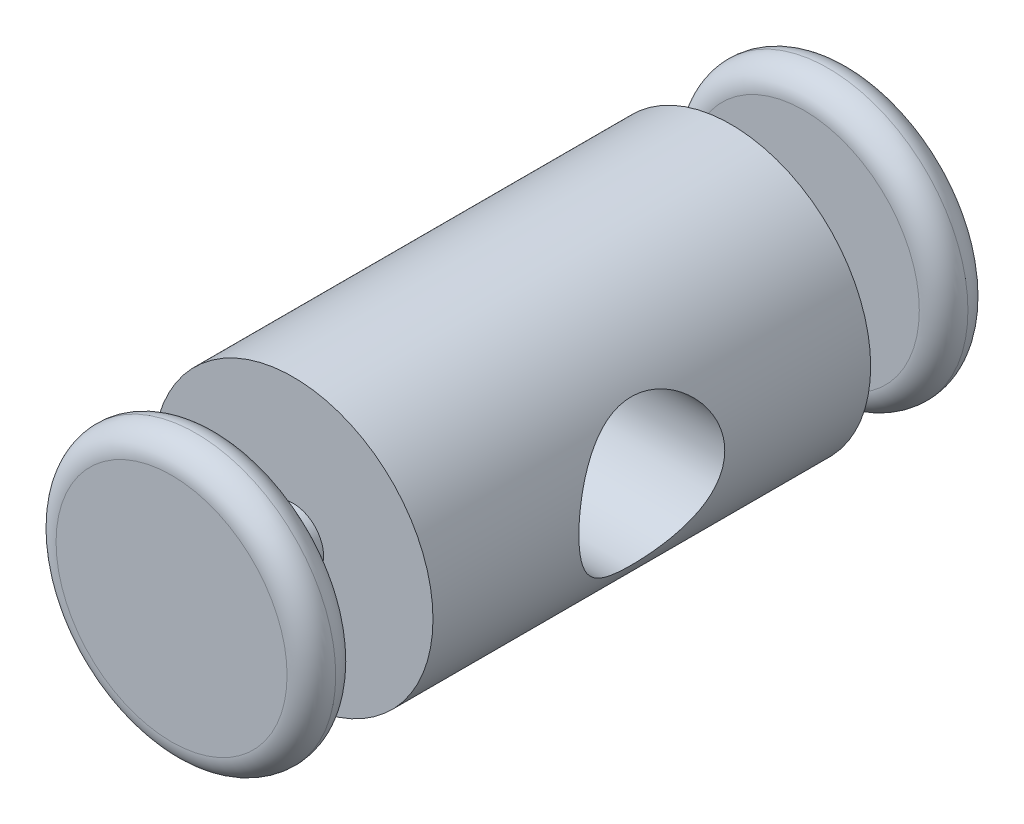
from build123d import *

# Parameters (mm, degrees)
SKETCH1_R               = 11.5
BOSS_EXTRUDE1_DEPTH     = 18
SKETCH2_R               = 2.5
BOSS_EXTRUDE2_DEPTH     = 6
SKETCH3_R               = 11.5
BOSS_EXTRUDE3_DEPTH     = 4
FILLET1_R               = 2
CUT_EXTRUDE2_DEPTH      = 33.380549753
CUT_EXTRUDE2_DEPTH_BACK = 33.380549753
SKETCH5_R               = 6


with BuildPart() as part:
    # Sketch1 → Boss-Extrude1 (new body)
    with BuildSketch(Plane.XY):
        Circle(SKETCH1_R)
    extrude(amount=BOSS_EXTRUDE1_DEPTH)

    # Sketch2 → Boss-Extrude2 (add)
    with BuildSketch(Plane.XY.offset(18)):
        Circle(SKETCH2_R)
    extrude(amount=BOSS_EXTRUDE2_DEPTH)

    # Sketch3 → Boss-Extrude3 (add)
    with BuildSketch(Plane.XY.offset(24)):
        Circle(SKETCH3_R)
    extrude(amount=BOSS_EXTRUDE3_DEPTH)

    # Fillet1
    fillet1_edges = [part.edges().sort_by_distance(p)[0] for p in [
        (-11.5, 0, 24),
        (-11.5, 0, 28),
    ]]
    fillet(fillet1_edges, radius=FILLET1_R - 0.0001)  # a hair under: the kernel refuses the full size

    # Mirror1: part across plane


with BuildPart() as part_1:
    add(part.part)
    add(part.part.mirror(Plane.XY))

    # Sketch5 → Cut-Extrude2 (cut, two sides: drawn at the far end of the back side and taken through both)
    with BuildSketch(Plane(origin=(0, 0, 0), x_dir=(0, 0, -1), z_dir=(1, 0, 0)).offset(-CUT_EXTRUDE2_DEPTH_BACK)):
        Circle(SKETCH5_R)
    extrude(amount=CUT_EXTRUDE2_DEPTH + CUT_EXTRUDE2_DEPTH_BACK, mode=Mode.SUBTRACT)


solid = part_1.part
